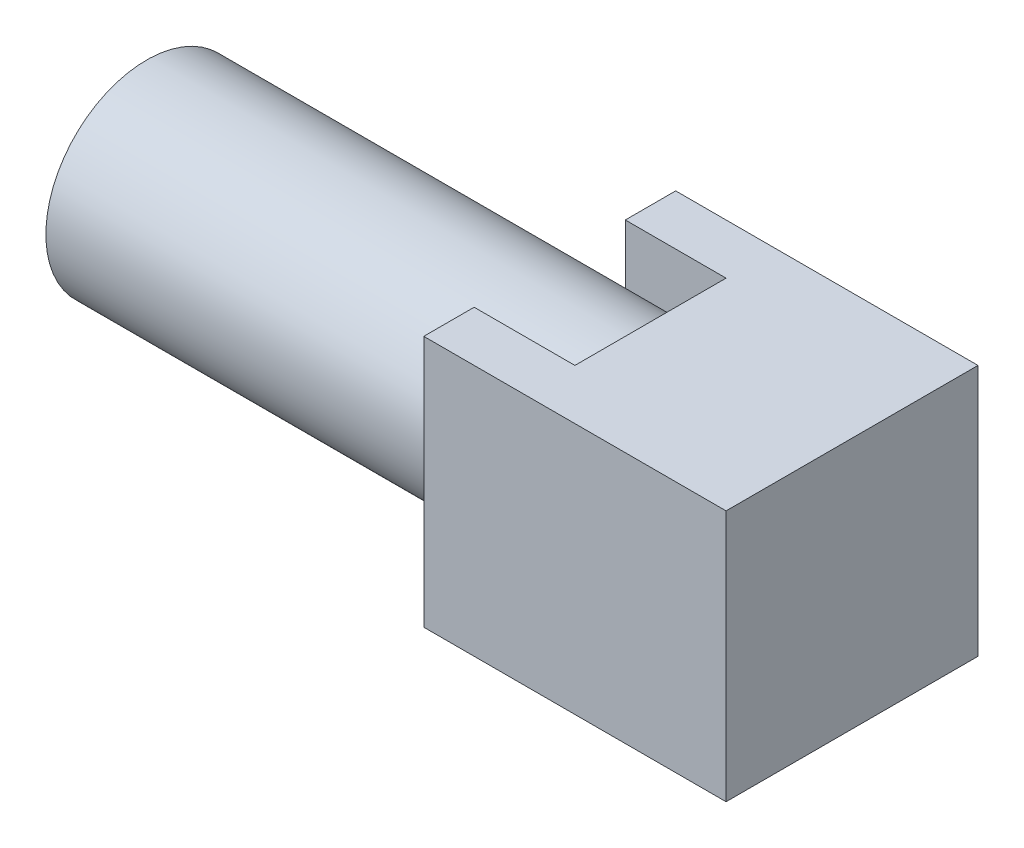
from build123d import *

# Parameters (mm, degrees)
SKETCH2_R           = 12.7
BOSS_EXTRUDE1_DEPTH = 63.5
SKETCH3_W           = 31.75
SKETCH3_H           = 31.75
BOSS_EXTRUDE2_DEPTH = 25.4
SKETCH6_W           = 12.7
SKETCH6_H           = 31.75
BOSS_EXTRUDE3_DEPTH = 6.35


with BuildPart() as part:
    # Sketch2 → Boss-Extrude1 (new body)
    with BuildSketch(Plane(origin=(0, 0, 0), x_dir=(0, 0, -1), z_dir=(1, 0, 0))):
        Circle(SKETCH2_R)
    extrude(amount=BOSS_EXTRUDE1_DEPTH)

    # Sketch3 → Boss-Extrude2 (add)
    with BuildSketch(Plane(origin=(63.5, 0, 0), x_dir=(0, 0, -1), z_dir=(1, 0, 0))):
        Rectangle(SKETCH3_W, SKETCH3_H)
    extrude(amount=BOSS_EXTRUDE2_DEPTH)

    # Sketch6 → Boss-Extrude3 (add)
    with BuildSketch(Plane(origin=(0, 0, -15.875), x_dir=(-1, 0, 0), z_dir=(0, 0, -1))):
        with Locations((-57.15, 0)):
            Rectangle(SKETCH6_W, SKETCH6_H)
    boss_extrude3 = extrude(amount=-BOSS_EXTRUDE3_DEPTH)

    # Mirror1: Boss-Extrude3 across plane
    add(boss_extrude3.mirror(Plane.XY))


solid = part.part
